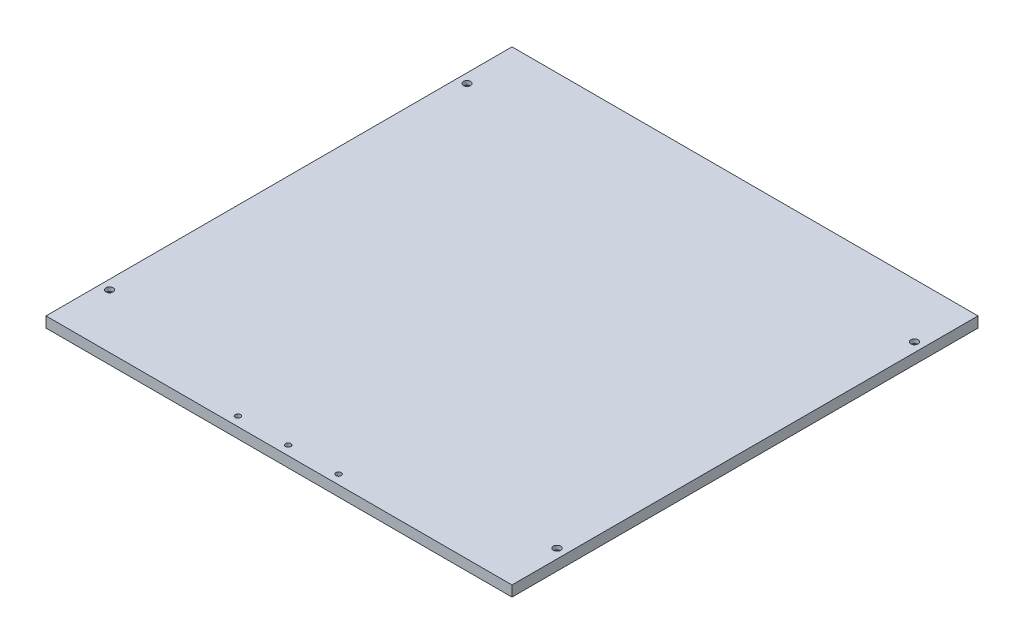
from build123d import *

# Parameters (mm, degrees)
PLATESKETCH2_W         = 352
PLATESKETCH2_H         = 352
PLATESKETCH2_R         = 2
BOSS_EXTRUDE1_DEPTH    = 8
BORESKETCH1_R          = 2.75
BORECUT_EXTRUDE1_DEPTH = 3


with BuildPart() as part:
    # PlateSketch2 → Boss-Extrude1 (new body)
    with BuildSketch(Plane(origin=(0, 0, 0), x_dir=(1, 0, 0), z_dir=(0, 1, 0))):
        with Locations((176, 176)):
            Rectangle(PLATESKETCH2_W, PLATESKETCH2_H)
        with Locations((7, 311)):
            Circle(PLATESKETCH2_R, mode=Mode.SUBTRACT)
        with Locations((345, 311)):
            Circle(PLATESKETCH2_R, mode=Mode.SUBTRACT)
        with Locations((138, 7)):
            Circle(PLATESKETCH2_R, mode=Mode.SUBTRACT)
        with Locations((176, 7)):
            Circle(PLATESKETCH2_R, mode=Mode.SUBTRACT)
        with Locations((214, 7)):
            Circle(PLATESKETCH2_R, mode=Mode.SUBTRACT)
        with Locations((7, 41)):
            Circle(PLATESKETCH2_R, mode=Mode.SUBTRACT)
        with Locations((345, 41)):
            Circle(PLATESKETCH2_R, mode=Mode.SUBTRACT)
    extrude(amount=BOSS_EXTRUDE1_DEPTH)

    # BoreSketch1 → BoreCut-Extrude1 (cut)
    with BuildSketch(Plane(origin=(0, 8, 0), x_dir=(1, 0, 0), z_dir=(0, 1, 0))):
        with Locations((7, 311)):
            Circle(BORESKETCH1_R)
        with Locations((345, 311)):
            Circle(BORESKETCH1_R)
        with Locations((7, 41)):
            Circle(BORESKETCH1_R)
        with Locations((345, 41)):
            Circle(BORESKETCH1_R)
    extrude(amount=-BORECUT_EXTRUDE1_DEPTH, mode=Mode.SUBTRACT)


solid = part.part
